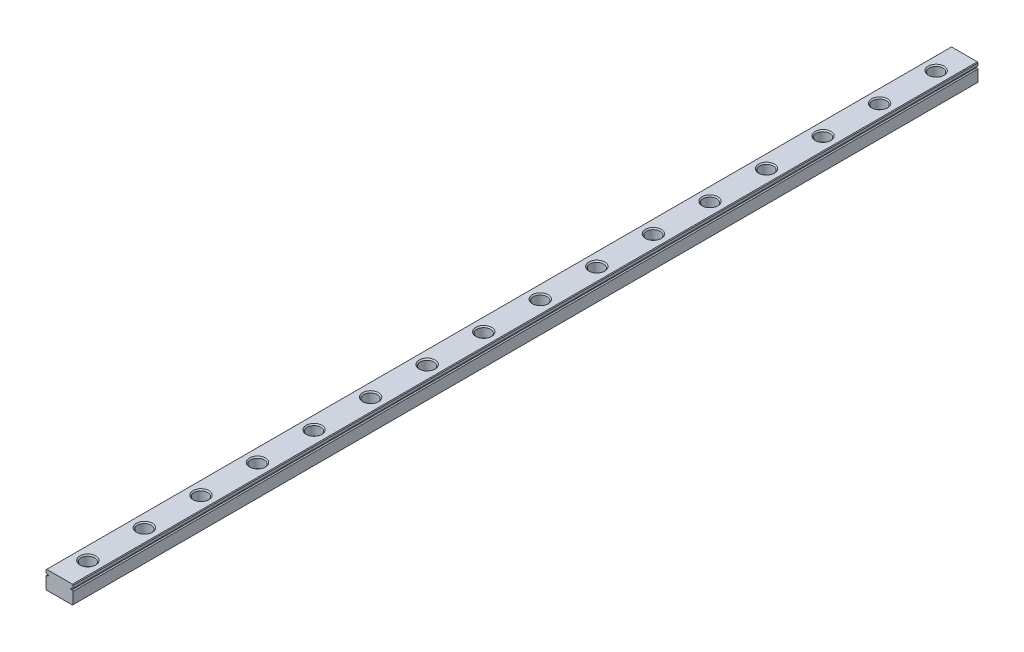
from build123d import *

# Parameters (mm, degrees)
BOSS_EXTRUDE1_DEPTH = 400
CHAMFER1_SIZE       = 0.3
LPATTERN1_COUNT     = 16
LPATTERN1_PITCH     = 25


with BuildPart() as part:
    # Sketch1 → Boss-Extrude1 (new body)
    with BuildSketch(Plane.XY):
        with BuildLine():
            Line((-6, 4), (6, 4))
            Line((6, 4), (6, 2.75))
            Line((6, 2.75), (6, 2.559016994))
            ThreePointArc((6, 2.559016994), (5.706107374, 2.475528258), (5.5, 2.25))
            Line((5.5, 2.25), (5, 2.25))
            Line((5, 2.25), (5, 1.75))
            Line((5, 1.75), (5.5, 1.75))
            ThreePointArc((5.5, 1.75), (5.706107374, 1.524471742), (6, 1.440983006))
            Line((6, 1.440983006), (6, 1.25))
            Line((6, 1.25), (6, -4))
            Line((6, -4), (-6, -4))
            Line((-6, -4), (-6, 1.25))
            Line((-6, 1.25), (-6, 1.440983006))
            ThreePointArc((-6, 1.440983006), (-5.706107374, 1.524471742), (-5.5, 1.75))
            Line((-5.5, 1.75), (-5, 1.75))
            Line((-5, 1.75), (-5, 2.25))
            Line((-5, 2.25), (-5.5, 2.25))
            ThreePointArc((-5.5, 2.25), (-5.706107374, 2.475528258), (-6, 2.559016994))
            Line((-6, 2.559016994), (-6, 2.75))
            Line((-6, 2.75), (-6, 4))
        make_face()
    extrude(amount=BOSS_EXTRUDE1_DEPTH)

    # Chamfer1
    chamfer1_edges = [part.edges().sort_by_distance(p)[0] for p in [
        (-6, -4, 200),
        (6, -4, 200),
        (-6, 4, 200),
        (6, 4, 200),
    ]]
    chamfer(chamfer1_edges, length=CHAMFER1_SIZE)

    # Sketch3 → M3 六角承窩頭蓋螺釘的柱孔1 (revolve, cut)
    with BuildSketch(Plane(origin=(0, 4, 12.5), x_dir=(0, 0, 1), z_dir=(1, 0, 0))):
        Polygon((0, 0), (0, 8), (2, 8), (1.75, 7.75), (1.75, 4.5), (3, 4.5), (3, 0.5), (3.5, 0), align=None)
    hole_wizard_m3_1 = revolve(axis=Axis((0, 10.35, 12.5), (0, -1, 0)), mode=Mode.SUBTRACT)

    # LPattern1: M3 六角承窩頭蓋螺釘的柱孔1 ×16
    with Locations(*[(0, 0, i * LPATTERN1_PITCH) for i in range(1, LPATTERN1_COUNT)]):
        add(hole_wizard_m3_1, mode=Mode.SUBTRACT)


solid = part.part
